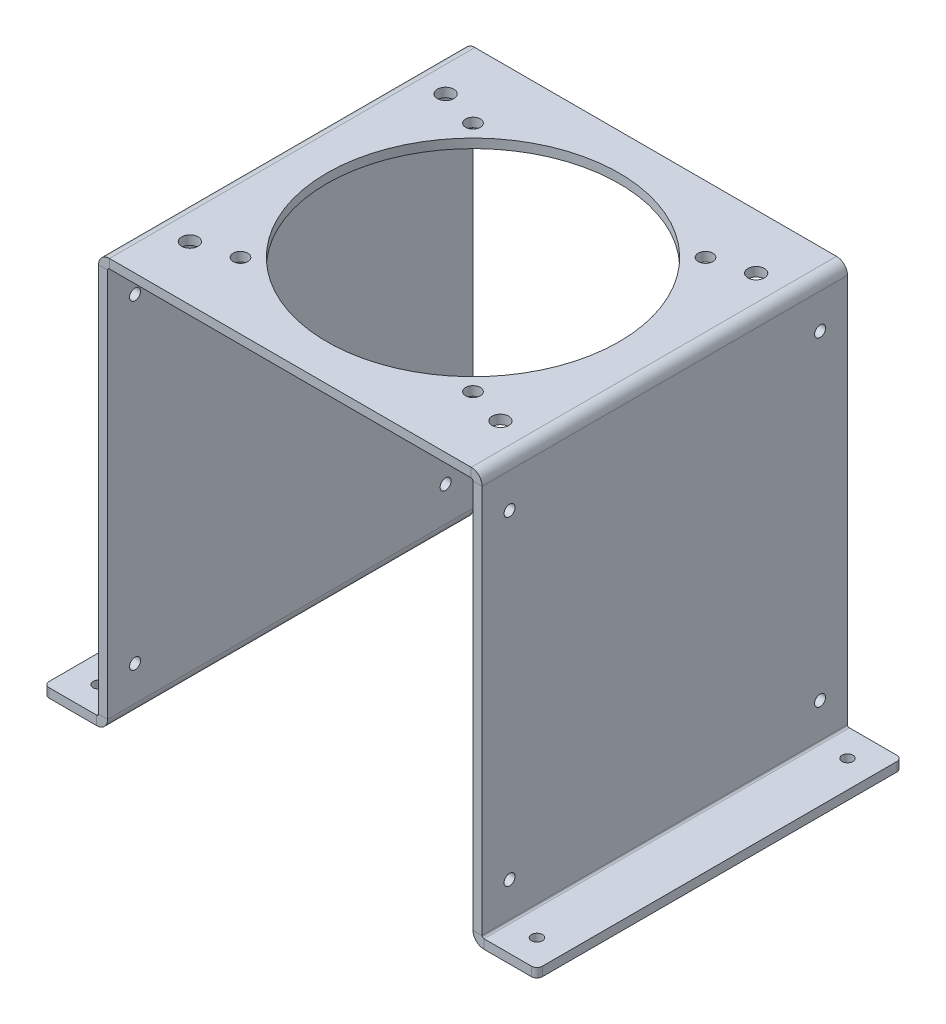
from build123d import *

# Parameters (mm, degrees)
BASE_FLANGE1_START = -100
BASE_FLANGE1_DEPTH = 200
CUT_EXTRUDE1_REACH = 282.802
SKETCH6_R          = 3
CUT_EXTRUDE2_REACH = 282.802
SKETCH7_R          = 80
SKETCH7_R_2        = 4
CUT_EXTRUDE3_REACH = 345.839
SKETCH8_R          = 3
FILLET1_R          = 3
CUT_EXTRUDE4_REACH = 282.802
SKETCH9_R          = 4.5


# Read off the part's stored shape, not the designer's step: Base-Flange1
with BuildPart() as part:
    # Base-Flange1 outline → Base-Flange1 (new body)
    with BuildSketch(Plane.XY.offset(BASE_FLANGE1_START)):
        with BuildLine():
            Line((-106, 5), (-135, 5))
            Line((-135, 5), (-135, 0))
            Line((-135, 0), (-106, 0))
            ThreePointArc((-106, 0), (-101.757359313, 1.757359313), (-100, 6))
            Line((-100, 6), (-100, 219))
            ThreePointArc((-100, 219), (-99.707106781, 219.707106781), (-99, 220))
            Line((-99, 220), (99, 220))
            ThreePointArc((99, 220), (99.707106781, 219.707106781), (100, 219))
            Line((100, 219), (100, 6))
            ThreePointArc((100, 6), (101.757359313, 1.757359313), (106, 0))
            Line((106, 0), (135, 0))
            Line((135, 0), (135, 5))
            Line((135, 5), (106, 5))
            ThreePointArc((106, 5), (105.292893219, 5.292893219), (105, 6))
            Line((105, 6), (105, 219))
            ThreePointArc((105, 219), (103.242640687, 223.242640687), (99, 225))
            Line((99, 225), (-99, 225))
            ThreePointArc((-99, 225), (-103.242640687, 223.242640687), (-105, 219))
            Line((-105, 219), (-105, 6))
            ThreePointArc((-105, 6), (-105.292893219, 5.292893219), (-106, 5))
        make_face()
    extrude(amount=BASE_FLANGE1_DEPTH)

    # Sketch6 → Cut-Extrude1 (cut, up to next)
    with BuildSketch(Plane.XZ, mode=Mode.PRIVATE) as cut_extrude1_sk1:
        with Locations((-120, 85)):
            Circle(SKETCH6_R)
    cut_extrude1_tool1 = extrude(cut_extrude1_sk1.sketch, amount=-CUT_EXTRUDE1_REACH, mode=Mode.PRIVATE) & part.part
    # Sketch6 → Cut-Extrude1 (cut, up to next)
    with BuildSketch(Plane.XZ, mode=Mode.PRIVATE) as cut_extrude1_sk2:
        with Locations((120, 85)):
            Circle(SKETCH6_R)
    cut_extrude1_tool2 = extrude(cut_extrude1_sk2.sketch, amount=-CUT_EXTRUDE1_REACH, mode=Mode.PRIVATE) & part.part
    # Sketch6 → Cut-Extrude1 (cut, up to next)
    with BuildSketch(Plane.XZ, mode=Mode.PRIVATE) as cut_extrude1_sk3:
        with Locations((120, -85)):
            Circle(SKETCH6_R)
    cut_extrude1_tool3 = extrude(cut_extrude1_sk3.sketch, amount=-CUT_EXTRUDE1_REACH, mode=Mode.PRIVATE) & part.part
    # Sketch6 → Cut-Extrude1 (cut, up to next)
    with BuildSketch(Plane.XZ, mode=Mode.PRIVATE) as cut_extrude1_sk4:
        with Locations((-120, -85)):
            Circle(SKETCH6_R)
    cut_extrude1_tool4 = extrude(cut_extrude1_sk4.sketch, amount=-CUT_EXTRUDE1_REACH, mode=Mode.PRIVATE) & part.part
    add(cut_extrude1_tool1.solids().sort_by_distance((-120, 0, 85))[0], mode=Mode.SUBTRACT)
    add(cut_extrude1_tool2.solids().sort_by_distance((120, 0, 85))[0], mode=Mode.SUBTRACT)
    add(cut_extrude1_tool3.solids().sort_by_distance((120, 0, -85))[0], mode=Mode.SUBTRACT)
    add(cut_extrude1_tool4.solids().sort_by_distance((-120, 0, -85))[0], mode=Mode.SUBTRACT)

    # Sketch7 → Cut-Extrude2 (cut, up to next)
    with BuildSketch(Plane(origin=(0, 225, 0), x_dir=(1, 0, 0), z_dir=(0, 1, 0)), mode=Mode.PRIVATE) as cut_extrude2_sk1:
        with Locations(Location((0, 0, 0), (0, 0, 180))):
            Circle(SKETCH7_R)
    cut_extrude2_tool1 = extrude(cut_extrude2_sk1.sketch, amount=-CUT_EXTRUDE2_REACH, mode=Mode.PRIVATE) & part.part
    # Sketch7 → Cut-Extrude2 (cut, up to next)
    with BuildSketch(Plane(origin=(0, 225, 0), x_dir=(1, 0, 0), z_dir=(0, 1, 0)), mode=Mode.PRIVATE) as cut_extrude2_sk2:
        with Locations(Location((-63.639610307, 63.639610307, 0), (0, 0, 180))):
            Circle(SKETCH7_R_2)
    cut_extrude2_tool2 = extrude(cut_extrude2_sk2.sketch, amount=-CUT_EXTRUDE2_REACH, mode=Mode.PRIVATE) & part.part
    # Sketch7 → Cut-Extrude2 (cut, up to next)
    with BuildSketch(Plane(origin=(0, 225, 0), x_dir=(1, 0, 0), z_dir=(0, 1, 0)), mode=Mode.PRIVATE) as cut_extrude2_sk3:
        with Locations((63.639610307, 63.639610307)):
            Circle(SKETCH7_R_2)
    cut_extrude2_tool3 = extrude(cut_extrude2_sk3.sketch, amount=-CUT_EXTRUDE2_REACH, mode=Mode.PRIVATE) & part.part
    # Sketch7 → Cut-Extrude2 (cut, up to next)
    with BuildSketch(Plane(origin=(0, 225, 0), x_dir=(1, 0, 0), z_dir=(0, 1, 0)), mode=Mode.PRIVATE) as cut_extrude2_sk4:
        with Locations(Location((63.639610307, -63.639610307, 0), (0, 0, 180))):
            Circle(SKETCH7_R_2)
    cut_extrude2_tool4 = extrude(cut_extrude2_sk4.sketch, amount=-CUT_EXTRUDE2_REACH, mode=Mode.PRIVATE) & part.part
    # Sketch7 → Cut-Extrude2 (cut, up to next)
    with BuildSketch(Plane(origin=(0, 225, 0), x_dir=(1, 0, 0), z_dir=(0, 1, 0)), mode=Mode.PRIVATE) as cut_extrude2_sk5:
        with Locations((-63.639610307, -63.639610307)):
            Circle(SKETCH7_R_2)
    cut_extrude2_tool5 = extrude(cut_extrude2_sk5.sketch, amount=-CUT_EXTRUDE2_REACH, mode=Mode.PRIVATE) & part.part
    add(cut_extrude2_tool1.solids().sort_by_distance((0, 225, 0))[0], mode=Mode.SUBTRACT)
    add(cut_extrude2_tool2.solids().sort_by_distance((-63.63961, 225, -63.63961))[0], mode=Mode.SUBTRACT)
    add(cut_extrude2_tool3.solids().sort_by_distance((63.63961, 225, -63.63961))[0], mode=Mode.SUBTRACT)
    add(cut_extrude2_tool4.solids().sort_by_distance((63.63961, 225, 63.63961))[0], mode=Mode.SUBTRACT)
    add(cut_extrude2_tool5.solids().sort_by_distance((-63.63961, 225, 63.63961))[0], mode=Mode.SUBTRACT)

    # Cut-Extrude3: up to this face of the body (flat: up to its plane)
    cut_extrude3_end = Plane(part.part.faces().sort_by_distance((-105, 112.5, 0))[0])
    # Sketch8 → Cut-Extrude3 (cut, up to the picked face)
    with BuildSketch(Plane(origin=(105, 0, 0), x_dir=(0, 0, -1), z_dir=(1, 0, 0)), mode=Mode.PRIVATE) as cut_extrude3_sk1:
        with Locations(Location((85, 200, 0), (0, 0, 90))):
            Circle(SKETCH8_R)
    cut_extrude3_tool1 = split(extrude(cut_extrude3_sk1.sketch, amount=-CUT_EXTRUDE3_REACH, mode=Mode.PRIVATE), bisect_by=cut_extrude3_end, keep=Keep.BOTH, mode=Mode.PRIVATE)
    # Sketch8 → Cut-Extrude3 (cut, up to the picked face)
    with BuildSketch(Plane(origin=(105, 0, 0), x_dir=(0, 0, -1), z_dir=(1, 0, 0)), mode=Mode.PRIVATE) as cut_extrude3_sk2:
        with Locations(Location((85, 25, 0), (0, 0, 90))):
            Circle(SKETCH8_R)
    cut_extrude3_tool2 = split(extrude(cut_extrude3_sk2.sketch, amount=-CUT_EXTRUDE3_REACH, mode=Mode.PRIVATE), bisect_by=cut_extrude3_end, keep=Keep.BOTH, mode=Mode.PRIVATE)
    # Sketch8 → Cut-Extrude3 (cut, up to the picked face)
    with BuildSketch(Plane(origin=(105, 0, 0), x_dir=(0, 0, -1), z_dir=(1, 0, 0)), mode=Mode.PRIVATE) as cut_extrude3_sk3:
        with Locations(Location((-85, 25, 0), (0, 0, 90))):
            Circle(SKETCH8_R)
    cut_extrude3_tool3 = split(extrude(cut_extrude3_sk3.sketch, amount=-CUT_EXTRUDE3_REACH, mode=Mode.PRIVATE), bisect_by=cut_extrude3_end, keep=Keep.BOTH, mode=Mode.PRIVATE)
    # Sketch8 → Cut-Extrude3 (cut, up to the picked face)
    with BuildSketch(Plane(origin=(105, 0, 0), x_dir=(0, 0, -1), z_dir=(1, 0, 0)), mode=Mode.PRIVATE) as cut_extrude3_sk4:
        with Locations(Location((-85, 200, 0), (0, 0, 90))):
            Circle(SKETCH8_R)
    cut_extrude3_tool4 = split(extrude(cut_extrude3_sk4.sketch, amount=-CUT_EXTRUDE3_REACH, mode=Mode.PRIVATE), bisect_by=cut_extrude3_end, keep=Keep.BOTH, mode=Mode.PRIVATE)
    add(cut_extrude3_tool1.solids().sort_by(Axis((105, 200, -85), (-1, 0, 0)))[0], mode=Mode.SUBTRACT)
    add(cut_extrude3_tool2.solids().sort_by(Axis((105, 25, -85), (-1, 0, 0)))[0], mode=Mode.SUBTRACT)
    add(cut_extrude3_tool3.solids().sort_by(Axis((105, 25, 85), (-1, 0, 0)))[0], mode=Mode.SUBTRACT)
    add(cut_extrude3_tool4.solids().sort_by(Axis((105, 200, 85), (-1, 0, 0)))[0], mode=Mode.SUBTRACT)

    # Fillet1
    fillet1_edges = [part.edges().sort_by_distance(p)[0] for p in [
        (135, 2.5, -100),
        (-135, 2.5, -100),
        (135, 2.5, 100),
        (-135, 2.5, 100),
    ]]
    fillet(fillet1_edges, radius=FILLET1_R)

    # Sketch9 → Cut-Extrude4 (cut, up to next)
    with BuildSketch(Plane(origin=(0, 225, 0), x_dir=(1, 0, 0), z_dir=(0, 1, 0)), mode=Mode.PRIVATE) as cut_extrude4_sk1:
        with Locations(Location((-85, 70, 0), (0, 0, 180))):
            Circle(SKETCH9_R)
    cut_extrude4_tool1 = extrude(cut_extrude4_sk1.sketch, amount=-CUT_EXTRUDE4_REACH, mode=Mode.PRIVATE) & part.part
    # Sketch9 → Cut-Extrude4 (cut, up to next)
    with BuildSketch(Plane(origin=(0, 225, 0), x_dir=(1, 0, 0), z_dir=(0, 1, 0)), mode=Mode.PRIVATE) as cut_extrude4_sk2:
        with Locations((85, 70)):
            Circle(SKETCH9_R)
    cut_extrude4_tool2 = extrude(cut_extrude4_sk2.sketch, amount=-CUT_EXTRUDE4_REACH, mode=Mode.PRIVATE) & part.part
    # Sketch9 → Cut-Extrude4 (cut, up to next)
    with BuildSketch(Plane(origin=(0, 225, 0), x_dir=(1, 0, 0), z_dir=(0, 1, 0)), mode=Mode.PRIVATE) as cut_extrude4_sk3:
        with Locations(Location((85, -70, 0), (0, 0, 180))):
            Circle(SKETCH9_R)
    cut_extrude4_tool3 = extrude(cut_extrude4_sk3.sketch, amount=-CUT_EXTRUDE4_REACH, mode=Mode.PRIVATE) & part.part
    # Sketch9 → Cut-Extrude4 (cut, up to next)
    with BuildSketch(Plane(origin=(0, 225, 0), x_dir=(1, 0, 0), z_dir=(0, 1, 0)), mode=Mode.PRIVATE) as cut_extrude4_sk4:
        with Locations((-85, -70)):
            Circle(SKETCH9_R)
    cut_extrude4_tool4 = extrude(cut_extrude4_sk4.sketch, amount=-CUT_EXTRUDE4_REACH, mode=Mode.PRIVATE) & part.part
    add(cut_extrude4_tool1.solids().sort_by_distance((-85, 225, -70))[0], mode=Mode.SUBTRACT)
    add(cut_extrude4_tool2.solids().sort_by_distance((85, 225, -70))[0], mode=Mode.SUBTRACT)
    add(cut_extrude4_tool3.solids().sort_by_distance((85, 225, 70))[0], mode=Mode.SUBTRACT)
    add(cut_extrude4_tool4.solids().sort_by_distance((-85, 225, 70))[0], mode=Mode.SUBTRACT)


solid = part.part
